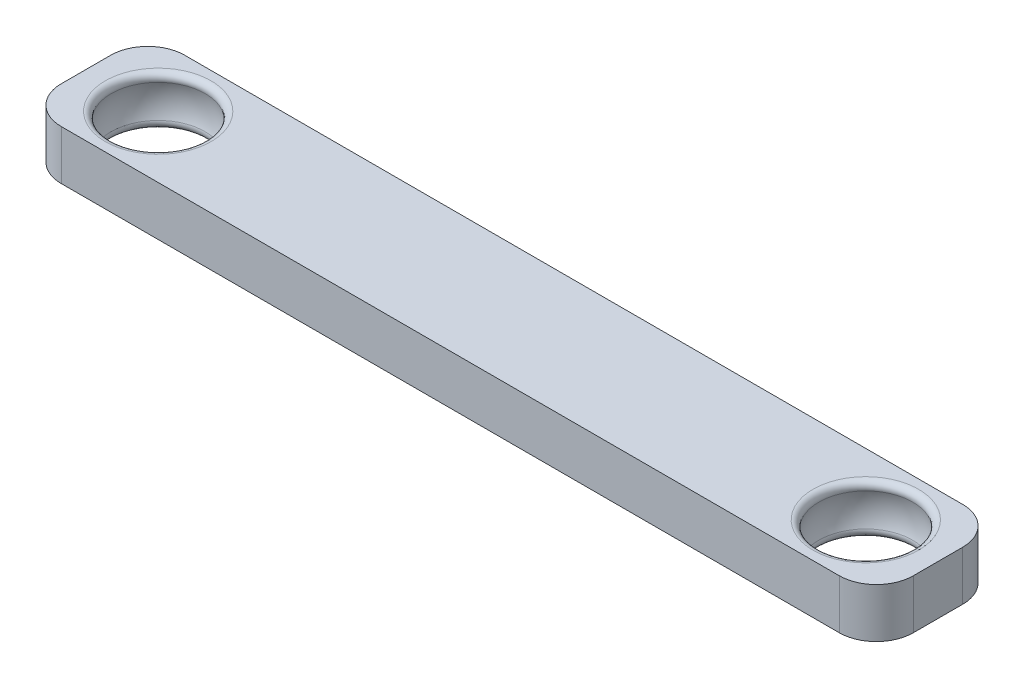
from build123d import *

# Parameters (mm, degrees)
SKETCH1_W           = 69
SKETCH1_H           = 10
BOSS_EXTRUDE1_DEPTH = 4
FILLET1_R           = 3
FILLET2_R           = 0.5


with BuildPart() as part:
    # Sketch1 → Boss-Extrude1 (new body)
    with BuildSketch(Plane(origin=(0, 0, 0), x_dir=(1, 0, 0), z_dir=(0, 1, 0))):
        Rectangle(SKETCH1_W, SKETCH1_H)
    extrude(amount=BOSS_EXTRUDE1_DEPTH)

    # Sketch2 → Cut-Revolve2 (revolve, cut)
    with BuildSketch(Plane.XY):
        with BuildLine():
            Line((-28.65, 4), (-28.65, 0))
            Line((-28.65, 0), (-32.15, 0))
            ThreePointArc((-32.15, 0), (-32.681128874, 2), (-32.15, 4))
            Line((-32.15, 4), (-28.65, 4))
        make_face()
    cut_revolve2 = revolve(axis=Axis((-28.65, 4, 0), (0, -1, 0)), mode=Mode.SUBTRACT)

    # Fillet1
    fillet1_edges = [part.edges().sort_by_distance(p)[0] for p in [
        (34.5, 2, -5),
        (34.5, 2, 5),
        (-34.5, 2, -5),
        (-34.5, 2, 5),
    ]]
    fillet(fillet1_edges, radius=FILLET1_R)

    # Mirror1: Cut-Revolve2 across plane
    add(cut_revolve2.mirror(Plane(origin=(0, 0, 0), x_dir=(0, 0, 1), z_dir=(1, 0, 0))), mode=Mode.SUBTRACT)

    # Fillet2
    fillet2_edges = [part.edges().sort_by_distance(p)[0] for p in [
        (-25.15, 0, 0),
        (25.15, 0, 0),
        (25.15, 4, 0),
        (-25.15, 4, 0),
    ]]
    fillet(fillet2_edges, radius=FILLET2_R)


solid = part.part
